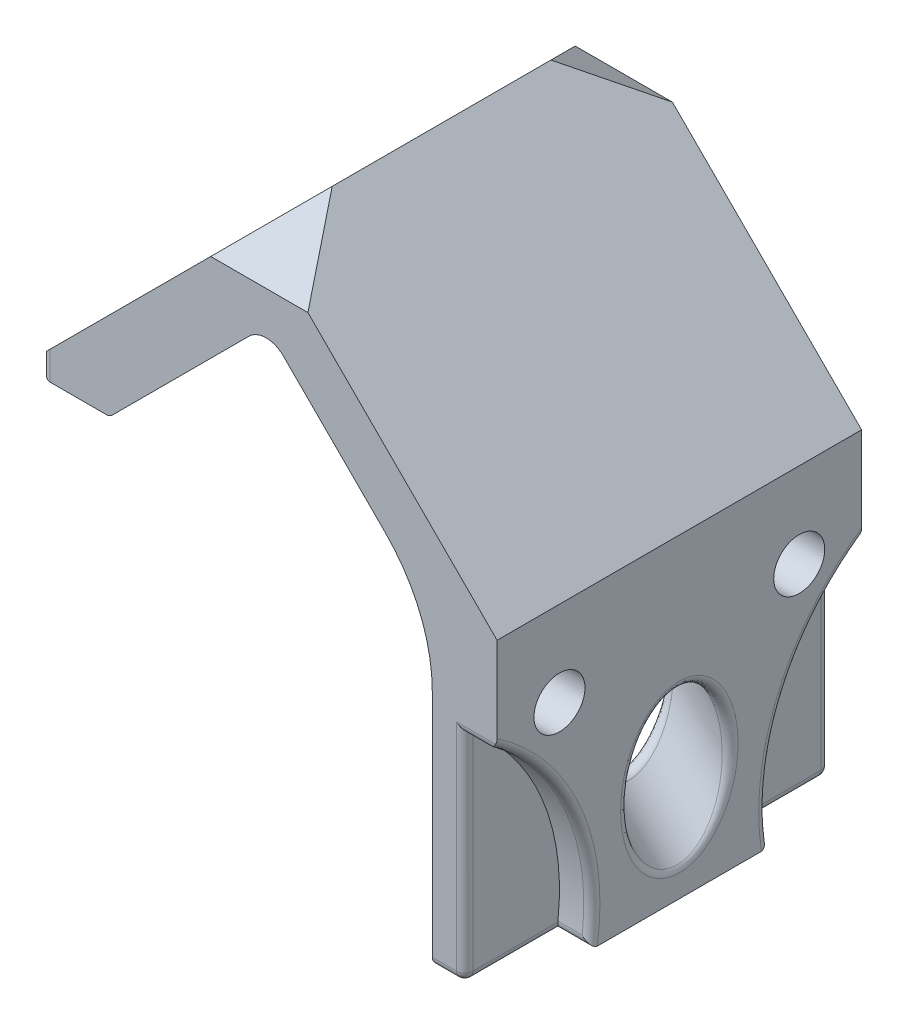
from build123d import *

# Parameters (mm, degrees)
EXTRUDE_506_DEPTH      = 22.5
SKETCH_2_R             = 3.125
SMA_DEPTH              = 42.358123054
SKETCH_3_R             = 1.575
CUT_EXTRUDE_958_DEPTH  = 41.923198727
CUT_EXTRUDE_2_DEPTH    = 1.25
CUT_EXTRUDE_1674_DEPTH = 42.700155069
FILLET_1_R             = 10
FILLET_2_R             = 1.5
SKETCH_8_R             = 14
CUT_EXTRUDE_1_DEPTH    = 2
FILLET_3_R             = 0.5
FILLET_4_R             = 0.5


with BuildPart() as part:
    # Sketch 1 → Extrude 506 (new body)
    with BuildSketch(Plane.XY):
        Polygon((14.253048327, 0), (14.253048327, -19.446194078), (10.253048327, -19.446194078), (10.253048327, -0.596194078), (0, 9.656854249), (-9.656854249, 0), (-13.859292911, 0), (-13.859292911, 1.242283553), (-0.424264069, 14.677312396), align=None)
    extrude(amount=EXTRUDE_506_DEPTH)

    # Sketch 2 → SMA接口 (cut, through all)
    with BuildSketch(Plane(origin=(-7.550788232, 7.550788232, 0), x_dir=(0, 0, 1), z_dir=(-0.7071067811865486, 0.7071067811865465, 0))):
        with Locations(Location((11.25, 0.578427125, 0), (0, 0, 270))):
            Circle(SKETCH_2_R)
    extrude(amount=-SMA_DEPTH, mode=Mode.SUBTRACT)

    # 草图3 → Cut-Extrude 958 (cut, through all)
    with BuildSketch(Plane(origin=(14.253048327, 0, 0), x_dir=(0, 0, -1), z_dir=(1, 0, 0))):
        with Locations(Location((-18.65, -5.25, 0), (0, 0, 90))):
            Circle(SKETCH_3_R)
        with Locations(Location((-3.85, -5.25, 0), (0, 0, 90))):
            Circle(SKETCH_3_R)
    extrude(amount=-CUT_EXTRUDE_958_DEPTH, mode=Mode.SUBTRACT)

    # 草图4 → 侧板接口-2 (cut)
    with BuildSketch(Plane.ZY.offset(-10.253048327)):
        Polygon((5.43771324, -8), (7.025426481, -5.25), (5.43771324, -2.5), (2.26228676, -2.5), (0.674573519, -5.25), (2.26228676, -8), align=None)
        Polygon((20.23771324, -8), (21.825426481, -5.25), (20.23771324, -2.5), (17.06228676, -2.5), (15.474573519, -5.25), (17.06228676, -8), align=None)
    extrude(amount=-CUT_EXTRUDE_2_DEPTH, mode=Mode.SUBTRACT)

    # 草图7 → Cut-Extrude 1674 (cut, through all)
    with BuildSketch(Plane(origin=(0, 8.084293197, -5.389528798), x_dir=(-1, 0, 0), z_dir=(0, -0.8320502943378436, 0.5547001962252295))):
        Polygon((0.424264069, -11.885734391), (-2.575735931, -6.477407477), (3.424264069, -6.477407477), align=None)
    cut_extrude_1674 = extrude(amount=-CUT_EXTRUDE_1674_DEPTH, mode=Mode.SUBTRACT)

    # 镜向1: Cut-Extrude 1674 across plane
    add(cut_extrude_1674.mirror(Plane.XY.offset(11.25)), mode=Mode.SUBTRACT)

    # 圆角1
    # the kernel refuses this fillet: 10 mm, written as the material it adds along each edge
    with BuildSketch(Plane(origin=(10.253048327, -0.596194078, 0), x_dir=(-0.7071067811865485, 0.7071067811865465, 0), z_dir=(0, 0, 1))) as fillet_1_piece_1_section:
        with BuildLine():
            CenterArc((FILLET_1_R * 0.414213562373, FILLET_1_R), FILLET_1_R, 225, 45)
            Line((-FILLET_1_R * 0.292893218813, FILLET_1_R * 0.292893218813), (0, 0))
            Line((0, 0), (FILLET_1_R * 0.414213562373, 0))
        make_face()
    fillet_1_piece_1 = extrude(amount=22.5, mode=Mode.PRIVATE)
    fillet_1_piece_1 = split(fillet_1_piece_1, bisect_by=Plane(origin=(9.563373888, -2.5, 1.639804469), z_dir=(0, 1, 0)), keep=Keep.TOP, mode=Mode.PRIVATE)
    add(fillet_1_piece_1)
    with BuildSketch(Plane(origin=(10.253048327, -0.596194078, 0), x_dir=(-0.7071067811865485, 0.7071067811865465, 0), z_dir=(0, 0, 1))) as fillet_1_piece_2_section:
        with BuildLine():
            CenterArc((FILLET_1_R * 0.414213562373, FILLET_1_R), FILLET_1_R, 225, 45)
            Line((-FILLET_1_R * 0.292893218813, FILLET_1_R * 0.292893218813), (0, 0))
            Line((0, 0), (FILLET_1_R * 0.414213562373, 0))
        make_face()
    fillet_1_piece_2 = extrude(amount=32.855339059, mode=Mode.PRIVATE)
    fillet_1_piece_2 = split(fillet_1_piece_2, bisect_by=Plane(origin=(10.172877174, -3.429366256, 1.725716902), z_dir=(0, 0.49999999999999994, -0.8660254037844387)), keep=Keep.TOP, mode=Mode.PRIVATE)
    add(fillet_1_piece_2)
    with BuildSketch(Plane(origin=(10.253048327, -0.596194078, -10.355339059), x_dir=(-0.7071067811865485, 0.7071067811865465, 0), z_dir=(0, 0, 1))) as fillet_1_piece_3_section:
        with BuildLine():
            CenterArc((FILLET_1_R * 0.414213562373, FILLET_1_R), FILLET_1_R, 225, 45)
            Line((-FILLET_1_R * 0.292893218813, FILLET_1_R * 0.292893218813), (0, 0))
            Line((0, 0), (FILLET_1_R * 0.414213562373, 0))
        make_face()
    fillet_1_piece_3 = extrude(amount=43.210678119, mode=Mode.PRIVATE)
    fillet_1_piece_3 = split(fillet_1_piece_3, bisect_by=Plane(origin=(10.175607333, -5.420622351, 15.376064659), z_dir=(0, 0.5000000000000004, -0.8660254037844384)), keep=Keep.TOP, mode=Mode.PRIVATE)
    fillet_1_piece_3 = split(fillet_1_piece_3, bisect_by=Plane(origin=(10.175607333, -5.420622351, 7.123935341), z_dir=(0, 0.49999999999999967, 0.8660254037844389)), keep=Keep.TOP, mode=Mode.PRIVATE)
    add(fillet_1_piece_3)
    with BuildSketch(Plane(origin=(10.253048327, -0.596194078, -10.355339059), x_dir=(-0.7071067811865485, 0.7071067811865465, 0), z_dir=(0, 0, 1))) as fillet_1_piece_4_section:
        with BuildLine():
            CenterArc((FILLET_1_R * 0.414213562373, FILLET_1_R), FILLET_1_R, 225, 45)
            Line((-FILLET_1_R * 0.292893218813, FILLET_1_R * 0.292893218813), (0, 0))
            Line((0, 0), (FILLET_1_R * 0.414213562373, 0))
        make_face()
    fillet_1_piece_4 = extrude(amount=32.855339059, mode=Mode.PRIVATE)
    fillet_1_piece_4 = split(fillet_1_piece_4, bisect_by=Plane(origin=(10.172877174, -3.429366256, 20.774283098), z_dir=(0, 0.5000000000000006, 0.8660254037844384)), keep=Keep.TOP, mode=Mode.PRIVATE)
    add(fillet_1_piece_4)

    # 圆角2
    fillet_2_edges = [part.edges().sort_by_distance(p)[0] for p in [
        (0, 9.656854249, 11.25),
    ]]
    fillet(fillet_2_edges, radius=FILLET_2_R)

    # 草图8 → 切除-拉伸1 (cut)
    with BuildSketch(Plane(origin=(14.253048327, 0, 0), x_dir=(0, 0, -1), z_dir=(1, 0, 0))):
        with Locations((-30.65, -17.25)):
            Circle(SKETCH_8_R)
        with Locations((8.15, -17.25)):
            Circle(SKETCH_8_R)
    extrude(amount=-CUT_EXTRUDE_1_DEPTH, mode=Mode.SUBTRACT)

    # 圆角3
    fillet_3_edges = [part.edges().sort_by_distance(p)[0] for p in [
        (11.253048327, -19.446194078, 0),
        (12.253048327, -12.656491378, 0),
        (13.253048327, -5.866788678, 0),
        (12.253048327, -12.656491378, 22.5),
        (13.253048327, -5.866788678, 22.5),
        (13.253048327, -19.446194078, 16.823332593),
        (14.253048327, -11.850327818, 17.733207042),
        (12.253048327, -19.446194078, 19.661666297),
        (13.253048327, -19.446194078, 5.676667407),
        (12.253048327, -19.446194078, 2.838333703),
        (14.253048327, -11.850327818, 4.766792958),
        (11.253048327, -19.446194078, 22.5),
    ]]
    fillet(fillet_3_edges, radius=FILLET_3_R)

    # 圆角4
    fillet_4_edges = [part.edges().sort_by_distance(p)[0] for p in [
        (-13.859292911, 0.621141777, 0),
        (-13.859292911, 1.242283553, 11.25),
        (-9.656854249, 0, 11.25),
        (-13.859292911, 0, 11.25),
        (-2.209708691, 7.447145558, 11.25),
        (14.253048327, -9.015612359, 11.251993605),
        (10.253048327, -5.015612359, 11.248006395),
        (-4.932069799, 10.169506666, 11.25),
        (-13.859292911, 0.621141777, 22.5),
    ]]
    fillet(fillet_4_edges, radius=FILLET_4_R)


solid = part.part
